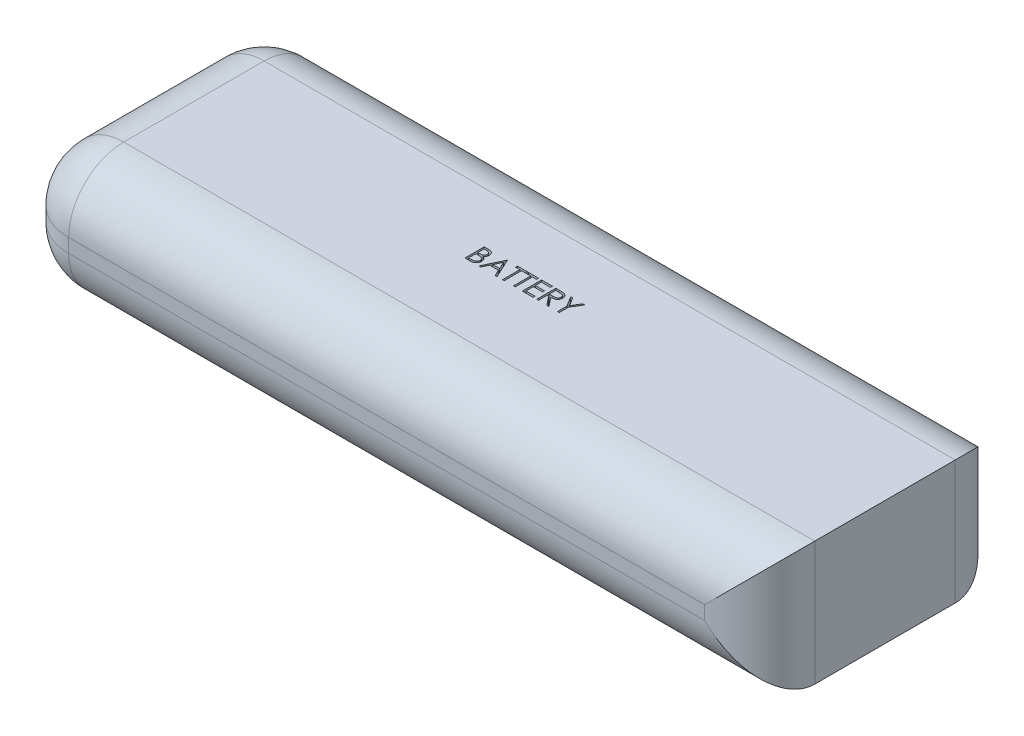
from build123d import *

# Parameters (mm, degrees)
SKETCH1_W           = 135.5
SKETCH1_H           = 45.5
BOSS_EXTRUDE1_DEPTH = 22.5
CUT_EXTRUDE1_DEPTH  = 12.7
FILLET2_R           = 10
FILLET3_R           = 10


with BuildPart() as part:
    # Sketch1 → Boss-Extrude1 (new body)
    with BuildSketch(Plane(origin=(0, 0, 0), x_dir=(1, 0, 0), z_dir=(0, 1, 0))):
        Rectangle(SKETCH1_W, SKETCH1_H)
    extrude(amount=BOSS_EXTRUDE1_DEPTH)

    # Sketch2 → Cut-Extrude1 (cut)
    # profile 1 of 7: a face of its own
    with BuildSketch(Plane(origin=(0, 22.5, 0), x_dir=(1, 0, 0), z_dir=(0, 1, 0))):
        with BuildLine():
            Line((-8.533149858, 3.5), (-7.85025723, 3.5))
            add(Edge.make_bspline(
                [(-7.85025723, 3.5), (-7.816828752, 3.49982425), (-7.752036041, 3.499483602), (-7.6578166, 3.49420047), (-7.569567789, 3.486996801), (-7.487264017, 3.475566708), (-7.410943314, 3.461774931), (-7.340375677, 3.445073115), (-7.275785505, 3.425046501), (-7.198672768, 3.39320022), (-7.110752107, 3.345877051), (-7.015553715, 3.275948486), (-6.934149475, 3.190416023), (-6.863963158, 3.093933368), (-6.808162038, 2.987797596), (-6.767792741, 2.874538407), (-6.742234866, 2.755616665), (-6.739606432, 2.673973487), (-6.738278063, 2.63271234)],
                knots=[0, 0, 0, 0, 1.001505555, 1.941167018, 2.826882275, 3.653841531, 4.429895133, 5.150066043, 5.825578002, 6.45369114, 7.647487171, 8.808567382, 9.977351308, 11.170798116, 12.373658725, 13.556498008, 14.765093433, 16, 16, 16, 16], degree=3))
            add(Edge.make_bspline(
                [(-6.738278063, 2.63271234), (-6.739371282, 2.594059784), (-6.741519559, 2.518103867), (-6.762062318, 2.407009758), (-6.794222987, 2.301258539), (-6.838928236, 2.201236154), (-6.897030232, 2.10920254), (-6.965888551, 2.024415274), (-7.048965353, 1.950464217), (-7.111208593, 1.909121315), (-7.142825339, 1.888120994)],
                knots=[0, 0, 0, 0, 1.044552857, 2.05264487, 3.044412934, 4.028983338, 5.005914585, 5.980388656, 6.974128949, 8, 8, 8, 8], degree=3))
            add(Edge.make_bspline(
                [(-7.142825339, 1.888120994), (-7.103064911, 1.872855995), (-7.026993364, 1.84365027), (-6.922307351, 1.792014806), (-6.832112506, 1.735852696), (-6.75571536, 1.674520846), (-6.690377706, 1.608412035), (-6.633324764, 1.536556921), (-6.58464339, 1.458018163), (-6.542930466, 1.373614627), (-6.51038171, 1.284208159), (-6.486005806, 1.190637383), (-6.472038357, 1.093237828), (-6.470050715, 1.026952448), (-6.469047294, 0.993489583)],
                knots=[0, 0, 0, 0, 1.27268992, 2.434971085, 3.483601985, 4.442670788, 5.356604649, 6.2567628, 7.179492994, 8.113709626, 9.066344395, 10.018646069, 10.999752585, 12, 12, 12, 12], degree=3))
            add(Edge.make_bspline(
                [(-6.469047294, 0.993489583), (-6.47002414, 0.959322711), (-6.471946112, 0.892098433), (-6.486126084, 0.793343299), (-6.510135191, 0.698968352), (-6.543206337, 0.608363169), (-6.586368652, 0.521703035), (-6.638896616, 0.438889771), (-6.70152818, 0.36075544), (-6.771591049, 0.286431817), (-6.850853194, 0.21960403), (-6.936368949, 0.160088323), (-7.029215269, 0.111142261), (-7.127867263, 0.070026239), (-7.233431579, 0.038619041), (-7.345434186, 0.016646467), (-7.463778488, 0.00184143), (-7.544988239, 0.000624225), (-7.586635435, 0)],
                knots=[0, 0, 0, 0, 0.978564426, 1.925352924, 2.850884081, 3.763762016, 4.682927383, 5.618979971, 6.567305752, 7.547517671, 8.540179244, 9.531824382, 10.526200242, 11.540722885, 12.589160233, 13.674978461, 14.80764778, 16, 16, 16, 16], degree=3))
            Line((-7.586635435, 0), (-8.533149858, 0))
            Line((-8.533149858, 0), (-8.533149858, 3.5))
        make_face()
        with BuildLine():
            Line((-8.219047294, 3.141025641), (-8.219047294, 2.019230769))
            Line((-8.219047294, 2.019230769), (-8.008009634, 2.019230769))
            add(Edge.make_bspline(
                [(-8.008009634, 2.019230769), (-7.977160838, 2.019630692), (-7.917554679, 2.020403425), (-7.831234783, 2.022616942), (-7.751109764, 2.028814985), (-7.677317931, 2.035011248), (-7.609975487, 2.045085835), (-7.549231626, 2.057077958), (-7.494133029, 2.069760863), (-7.430593483, 2.09133035), (-7.358520535, 2.123208025), (-7.281687431, 2.172679861), (-7.213952961, 2.231604215), (-7.156755773, 2.299595176), (-7.109944303, 2.374461362), (-7.077430588, 2.455008243), (-7.055383304, 2.539228375), (-7.053391772, 2.597046627), (-7.052380627, 2.626402244)],
                knots=[0, 0, 0, 0, 1.156816544, 2.235205308, 3.236616184, 4.169592532, 5.011045266, 5.787822928, 6.49130361, 7.128639758, 8.301311294, 9.436451833, 10.541879658, 11.654887649, 12.756523258, 13.837046038, 14.901820046, 16, 16, 16, 16], degree=3))
            add(Edge.make_bspline(
                [(-7.052380627, 2.626402244), (-7.052906807, 2.645828015), (-7.053938967, 2.683933787), (-7.06239227, 2.739483141), (-7.076759844, 2.791726894), (-7.095214138, 2.841381004), (-7.121002826, 2.886892854), (-7.15136629, 2.92983605), (-7.18805198, 2.968748169), (-7.229809293, 3.005117667), (-7.277817915, 3.037362195), (-7.332049207, 3.065602958), (-7.393236884, 3.088343735), (-7.460349739, 3.108259887), (-7.534420827, 3.122248181), (-7.61459538, 3.133901569), (-7.701530099, 3.139834311), (-7.761675202, 3.140619673), (-7.792765243, 3.141025641)],
                knots=[0, 0, 0, 0, 0.91205012, 1.789085906, 2.630437955, 3.453916878, 4.269457761, 5.079663411, 5.91843418, 6.774407191, 7.675494373, 8.627863946, 9.638891023, 10.736472738, 11.911756761, 13.175263542, 14.539845004, 16, 16, 16, 16], degree=3))
            Line((-7.792765243, 3.141025641), (-8.219047294, 3.141025641))
        make_face(mode=Mode.SUBTRACT)
        with BuildLine():
            Line((-8.219047294, 1.66025641), (-8.219047294, 0.358974359))
            Line((-8.219047294, 0.358974359), (-7.771731589, 0.358974359))
            add(Edge.make_bspline(
                [(-7.771731589, 0.358974359), (-7.739712663, 0.359358106), (-7.678000404, 0.360097729), (-7.588899174, 0.362512283), (-7.50631607, 0.368004559), (-7.430627935, 0.376650409), (-7.361017482, 0.386028858), (-7.298319779, 0.398640139), (-7.242026586, 0.413089099), (-7.176752278, 0.435423272), (-7.10324877, 0.470119743), (-7.024037913, 0.522433969), (-6.953611695, 0.584757277), (-6.893806436, 0.656888191), (-6.844793447, 0.735319518), (-6.809137992, 0.818464868), (-6.787147135, 0.904950395), (-6.784484966, 0.963917108), (-6.783149858, 0.993489583)],
                knots=[0, 0, 0, 0, 1.160039823, 2.235823828, 3.228722157, 4.157150951, 4.99529583, 5.772374946, 6.472645482, 7.099169577, 8.269452708, 9.405989375, 10.527446681, 11.663510218, 12.788923519, 13.866172445, 14.929861265, 16, 16, 16, 16], degree=3))
            add(Edge.make_bspline(
                [(-6.783149858, 0.993489583), (-6.783425962, 1.011982924), (-6.783973718, 1.048671306), (-6.792234332, 1.102587125), (-6.804248202, 1.154812998), (-6.819779636, 1.205490739), (-6.842399103, 1.253704115), (-6.868805648, 1.300406674), (-6.89976705, 1.345660154), (-6.948011216, 1.402872407), (-7.0181832, 1.46878942), (-7.117889976, 1.533326923), (-7.231262274, 1.58537473), (-7.313489767, 1.607474206), (-7.355966364, 1.618890224)],
                knots=[0, 0, 0, 0, 0.723448775, 1.435228256, 2.130040452, 2.821711965, 3.505591119, 4.210454504, 4.921174351, 5.648778258, 7.137944449, 8.670945889, 10.280296675, 12, 12, 12, 12], degree=3))
            add(Edge.make_bspline(
                [(-7.355966364, 1.618890224), (-7.37299546, 1.622345308), (-7.409918053, 1.629836643), (-7.470125633, 1.637744346), (-7.538861502, 1.644789406), (-7.616284379, 1.650000564), (-7.70249222, 1.655387107), (-7.797669139, 1.657481929), (-7.901426454, 1.659981189), (-7.973418826, 1.660162323), (-8.010814121, 1.66025641)],
                knots=[0, 0, 0, 0, 0.634451884, 1.375622551, 2.216452059, 3.157844607, 4.20941857, 5.370758133, 6.634282058, 8, 8, 8, 8], degree=3))
            Line((-8.010814121, 1.66025641), (-8.219047294, 1.66025641))
        make_face(mode=Mode.SUBTRACT)
    # profile 2 of 7: a face of its own
    with BuildSketch(Plane(origin=(0, 22.5, 0), x_dir=(1, 0, 0), z_dir=(0, 1, 0))):
        Polygon((-4.31520114, 3.5), (-2.699816525, 0), (-3.041262839, 0), (-3.558690723, 1.121794872), (-5.145329345, 1.121794872), (-5.677480788, 0), (-6.020329345, 0), (-4.360072935, 3.5), align=None)
        Polygon((-4.341142647, 2.817808494), (-4.974956749, 1.480769231), (-3.724155467, 1.480769231), align=None, mode=Mode.SUBTRACT)
    # profile 3 of 7: a face of its own
    with BuildSketch(Plane(origin=(0, 22.5, 0), x_dir=(1, 0, 0), z_dir=(0, 1, 0))):
        Polygon((-2.47545755, 3.141025641), (-2.47545755, 3.5), (-0.635713961, 3.5), (-0.635713961, 3.141025641), (-1.398534473, 3.141025641), (-1.398534473, 0), (-1.712637038, 0), (-1.712637038, 3.141025641), align=None)
    # profile 4 of 7: a face of its own
    with BuildSketch(Plane(origin=(0, 22.5, 0), x_dir=(1, 0, 0), z_dir=(0, 1, 0))):
        Polygon((-0.501098576, 3.141025641), (-0.501098576, 3.5), (1.338645014, 3.5), (1.338645014, 3.141025641), (0.575824501, 3.141025641), (0.575824501, 0), (0.261721937, 0), (0.261721937, 3.141025641), align=None)
    # profile 5 of 7: a face of its own
    with BuildSketch(Plane(origin=(0, 22.5, 0), x_dir=(1, 0, 0), z_dir=(0, 1, 0))):
        Polygon((1.877106552, 3.5), (3.851465527, 3.5), (3.851465527, 3.141025641), (2.191209116, 3.141025641), (2.191209116, 2.064102564), (3.851465527, 2.064102564), (3.851465527, 1.705128205), (2.191209116, 1.705128205), (2.191209116, 0.358974359), (3.851465527, 0.358974359), (3.851465527, 0), (1.877106552, 0), align=None)
    # profile 6 of 7: a face of its own
    with BuildSketch(Plane(origin=(0, 22.5, 0), x_dir=(1, 0, 0), z_dir=(0, 1, 0))):
        with BuildLine():
            Line((4.479670655, 3.5), (5.180091328, 3.5))
            add(Edge.make_bspline(
                [(5.180091328, 3.5), (5.226832456, 3.499844414), (5.316580601, 3.499545672), (5.445153871, 3.497879909), (5.561980968, 3.493105553), (5.667000807, 3.48899697), (5.760211462, 3.481505028), (5.841898753, 3.474344381), (5.911686451, 3.46497072), (5.953932302, 3.456265297), (5.973060078, 3.452323718)],
                knots=[0, 0, 0, 0, 1.410062039, 2.707475311, 3.878576406, 4.937260626, 5.877586885, 6.699081471, 7.410979367, 8, 8, 8, 8], degree=3))
            add(Edge.make_bspline(
                [(5.973060078, 3.452323718), (5.998666702, 3.445996953), (6.049333691, 3.433478389), (6.122283757, 3.407018788), (6.191798081, 3.376399163), (6.257587906, 3.340435443), (6.319323697, 3.298860663), (6.377642008, 3.252392541), (6.432807471, 3.201285335), (6.482589101, 3.144250494), (6.529528153, 3.084413984), (6.569116779, 3.019710227), (6.603243259, 2.9520487), (6.630413776, 2.880741282), (6.65229175, 2.80647951), (6.667717989, 2.728590713), (6.676969177, 2.647429738), (6.677911032, 2.59207183), (6.678388603, 2.564002404)],
                knots=[0, 0, 0, 0, 1.027469482, 2.033020251, 3.019912614, 3.986113645, 4.951240523, 5.91722682, 6.890402269, 7.87763091, 8.8651537, 9.85103654, 10.82876324, 11.815024772, 12.821070561, 13.842952187, 14.906261191, 16, 16, 16, 16], degree=3))
            add(Edge.make_bspline(
                [(6.678388603, 2.564002404), (6.676919605, 2.517367299), (6.67405321, 2.426370131), (6.647328106, 2.29430925), (6.603551586, 2.171119935), (6.543228297, 2.056957297), (6.466408821, 1.954046652), (6.37408403, 1.863656197), (6.266202419, 1.788016284), (6.165773103, 1.735563479), (6.077058903, 1.701970571), (6.00402559, 1.678334212), (5.924358613, 1.660072247), (5.838821278, 1.643712115), (5.747057623, 1.63136042), (5.649287583, 1.622313826), (5.545441432, 1.616659777), (5.474102362, 1.615817772), (5.437403027, 1.615384615)],
                knots=[0, 0, 0, 0, 1.260483769, 2.459530307, 3.627416485, 4.787058657, 5.939039949, 7.08810263, 8.267026773, 9.491475466, 10.141966685, 10.831826277, 11.566392101, 12.351337768, 13.187381173, 14.07005841, 15.007169909, 16, 16, 16, 16], degree=3))
            Line((5.437403027, 1.615384615), (6.723260398, 0))
            Line((6.723260398, 0), (6.334838924, 0))
            Line((6.334838924, 0), (5.048981552, 1.615384615))
            Line((5.048981552, 1.615384615), (4.793773219, 1.615384615))
            Line((4.793773219, 1.615384615), (4.793773219, 0))
            Line((4.793773219, 0), (4.479670655, 0))
            Line((4.479670655, 0), (4.479670655, 3.5))
        make_face()
        with BuildLine():
            Line((4.793773219, 3.141025641), (4.793773219, 1.974358974))
            Line((4.793773219, 1.974358974), (5.434598539, 1.969451122))
            add(Edge.make_bspline(
                [(5.434598539, 1.969451122), (5.464518578, 1.969437885), (5.522512135, 1.969412229), (5.6064128, 1.973406005), (5.684532912, 1.977949323), (5.756573664, 1.984898669), (5.822567239, 1.99385474), (5.882480653, 2.005057725), (5.936411705, 2.018109787), (5.999310243, 2.038311413), (6.069546774, 2.070317431), (6.145878234, 2.11688293), (6.210880572, 2.175452049), (6.265798434, 2.242425505), (6.309927866, 2.316061754), (6.34103992, 2.395478123), (6.360782362, 2.478669721), (6.363110908, 2.535847829), (6.364286039, 2.564703526)],
                knots=[0, 0, 0, 0, 1.146690395, 2.22261258, 3.21895312, 4.145990853, 4.996080663, 5.770904154, 6.481378293, 7.121626537, 8.300444488, 9.431385265, 10.535395872, 11.636531494, 12.74115979, 13.810798291, 14.895190096, 16, 16, 16, 16], degree=3))
            add(Edge.make_bspline(
                [(6.364286039, 2.564703526), (6.363083918, 2.592850099), (6.360701753, 2.648626338), (6.341252984, 2.730282248), (6.308363603, 2.807349198), (6.264041365, 2.879513683), (6.21004221, 2.945019419), (6.146724397, 3.001066572), (6.075819202, 3.047316037), (6.009548004, 3.076870418), (5.950313791, 3.094990271), (5.898884131, 3.107741435), (5.840772654, 3.117985904), (5.775697195, 3.126193964), (5.703935564, 3.133248909), (5.625124913, 3.138000687), (5.539788133, 3.140814551), (5.480641202, 3.14095364), (5.450023219, 3.141025641)],
                knots=[0, 0, 0, 0, 1.101028733, 2.181837193, 3.264309656, 4.369019818, 5.486613113, 6.575447106, 7.666700264, 8.788928104, 9.402425223, 10.0903467, 10.862060571, 11.710948788, 12.657782767, 13.684531032, 14.801375019, 16, 16, 16, 16], degree=3))
            Line((5.450023219, 3.141025641), (4.793773219, 3.141025641))
        make_face(mode=Mode.SUBTRACT)
    # profile 7 of 7: a face of its own
    with BuildSketch(Plane(origin=(0, 22.5, 0), x_dir=(1, 0, 0), z_dir=(0, 1, 0))):
        Polygon((7.171978347, 3.5), (7.531653828, 3.5), (8.451525623, 1.99609375), (9.369995174, 3.5), (9.729670655, 3.5), (8.607875783, 1.663762019), (8.607875783, 0), (8.293773219, 0), (8.293773219, 1.663762019), align=None)
    extrude(amount=-CUT_EXTRUDE1_DEPTH, mode=Mode.SUBTRACT)

    # Fillet2
    fillet2_edges = [part.edges().sort_by_distance(p)[0] for p in [
        (0, 22.5, 22.75),
        (0, 0, 22.75),
        (0, 0, -22.75),
        (67.75, 11.25, 22.75),
        (-67.75, 11.25, 22.75),
        (-67.75, 11.25, -22.75),
        (67.75, 11.25, -22.75),
        (0, 22.5, -22.75),
    ]]
    fillet(fillet2_edges, radius=FILLET2_R)

    # Fillet3
    # the kernel refuses this fillet: 10 mm, written as the material it takes off along each edge
    with BuildSketch(Plane(origin=(-57.75, 12.5, -12.75), x_dir=(-1, 0, 0), z_dir=(0, 1, 0))) as fillet3_piece_1_section:
        Polygon((0, 0), (FILLET3_R, 0), (FILLET3_R, -FILLET3_R), (0, -FILLET3_R), align=None)
    fillet3_piece_1 = extrude(amount=FILLET3_R, mode=Mode.PRIVATE)
    fillet3_piece_1 = fillet3_piece_1 - Plane(origin=(-57.75, 12.5, -12.75), x_dir=(0.7071067811865475, 0, 0.7071067811865475), z_dir=(0, 1, 0)) * Sphere(FILLET3_R, mode=Mode.PRIVATE)
    add(fillet3_piece_1, mode=Mode.SUBTRACT)
    with BuildSketch(Plane(origin=(-57.75, 10, -12.75), x_dir=(0, -1, 0), z_dir=(-1, 0, 0))) as fillet3_piece_2_section:
        Polygon((0, 0), (FILLET3_R, 0), (FILLET3_R, -FILLET3_R), (0, -FILLET3_R), align=None)
    fillet3_piece_2 = extrude(amount=FILLET3_R, mode=Mode.PRIVATE)
    fillet3_piece_2 = fillet3_piece_2 - Plane(origin=(-57.75, 10, -12.75), x_dir=(0, 0.7071067811865475, 0.7071067811865475), z_dir=(-1, 0, 0)) * Sphere(FILLET3_R, mode=Mode.PRIVATE)
    add(fillet3_piece_2, mode=Mode.SUBTRACT)
    with BuildSketch(Plane(origin=(-57.75, 12.5, 12.75), x_dir=(-1, 0, 0), z_dir=(0, 1, 0))) as fillet3_piece_3_section:
        Polygon((0, 0), (FILLET3_R, 0), (FILLET3_R, FILLET3_R), (0, FILLET3_R), align=None)
    fillet3_piece_3 = extrude(amount=FILLET3_R, mode=Mode.PRIVATE)
    fillet3_piece_3 = fillet3_piece_3 - Plane(origin=(-57.75, 12.5, 12.75), x_dir=(0.7071067811865475, 0, -0.7071067811865475), z_dir=(0, 1, 0)) * Sphere(FILLET3_R, mode=Mode.PRIVATE)
    add(fillet3_piece_3, mode=Mode.SUBTRACT)
    with BuildSketch(Plane(origin=(-57.75, 10, 12.75), x_dir=(0, -1, 0), z_dir=(-1, 0, 0))) as fillet3_piece_4_section:
        Polygon((0, 0), (FILLET3_R, 0), (FILLET3_R, FILLET3_R), (0, FILLET3_R), align=None)
    fillet3_piece_4 = extrude(amount=FILLET3_R, mode=Mode.PRIVATE)
    fillet3_piece_4 = fillet3_piece_4 - Plane(origin=(-57.75, 10, 12.75), x_dir=(0, 0.7071067811865475, -0.7071067811865475), z_dir=(-1, 0, 0)) * Sphere(FILLET3_R, mode=Mode.PRIVATE)
    add(fillet3_piece_4, mode=Mode.SUBTRACT)
    with BuildSketch(Plane(origin=(-67.75, 22.5, -12.75), x_dir=(1, 0, 0), z_dir=(0, 0, 1)), Plane(origin=(-67.75, 0, -12.75), x_dir=(0, 1, 0), z_dir=(0, 0, 1))) as fillet3_piece_5:
        with BuildLine():
            CenterArc((FILLET3_R, -FILLET3_R), FILLET3_R, 90, 90)
            Line((0, -FILLET3_R), (0, 0))
            Line((0, 0), (FILLET3_R, 0))
        make_face()
    extrude(amount=25.5, mode=Mode.SUBTRACT)


solid = part.part
